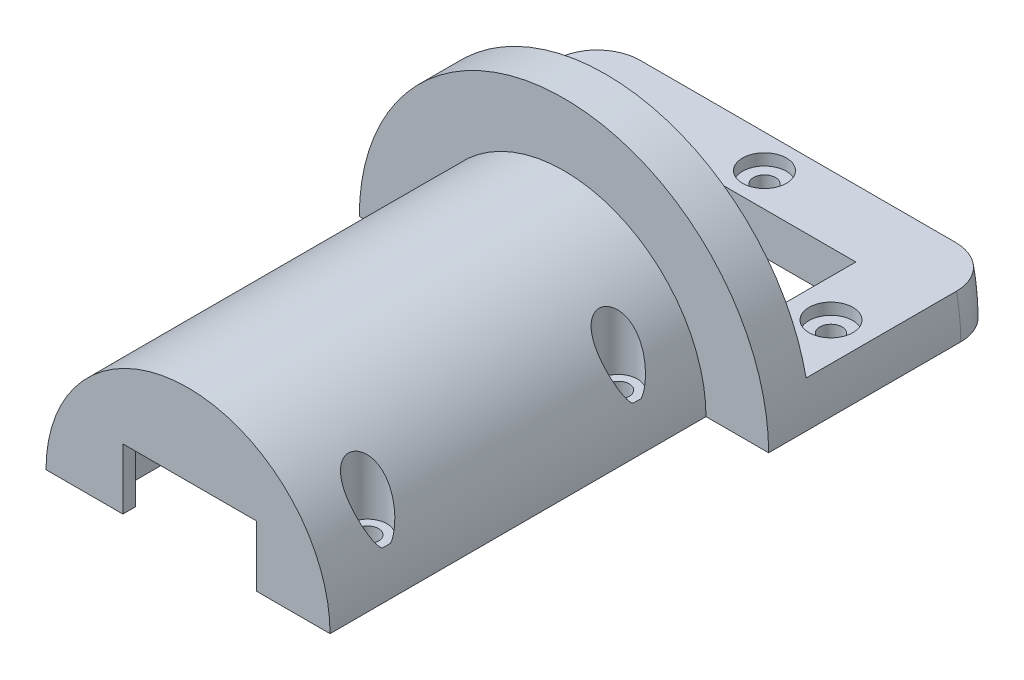
from build123d import *
from build123d.topology import SkipClean

# Parameters (mm, degrees)
ESQUISSE2_R                                      = 31.5
ESQUISSE2_W                                      = 32
ESQUISSE2_H                                      = 32
BOSS_EXTRU_1_DEPTH                               = 3
BOSS_EXTRU_2_START                               = -100
ESQUISSE4_R                                      = 35
ESQUISSE4_R_2                                    = 31.5
BOSS_EXTRU_2_DEPTH                               = 100
BOSS_EXTRU_3_OUTLINE_R                           = 31.5
BOSS_EXTRU_3_OUTLINE_W                           = 43
BOSS_EXTRU_3_OUTLINE_H                           = 42.5
BOSS_EXTRU_3_DEPTH                               = 97
ESQUISSE6_R                                      = 31.5
ENL_V_MAT_EXTRU_1_DEPTH                          = 10
ESQUISSE7_R                                      = 49
ESQUISSE7_R_2                                    = 35
BOSS_EXTRU_4_DEPTH                               = 10
BOSS_EXTRU_5_START                               = 30
BOSS_EXTRU_5_DEPTH                               = 30
BOSS_EXTRU_6_START                               = 16
BOSS_EXTRU_6_DEPTH                               = 16
CONG_1_R                                         = 10
ESQUISSE11_W                                     = 137.068824
ESQUISSE11_H                                     = 50.889867
ENL_V_MAT_EXTRU_2_DEPTH                          = 153
CHAMBRAGE_POUR_VIS_T_TE_RONDE_6_PANS_D           = 5.3
CHAMBRAGE_POUR_VIS_T_TE_RONDE_6_PANS_DEPTH       = 18
CHAMBRAGE_POUR_VIS_T_TE_RONDE_6_PANS_CBORE_D     = 10.5
CHAMBRAGE_POUR_VIS_T_TE_RONDE_6_PANS_CBORE_DEPTH = 2.75
CHAMBRAGE_POUR_VIS_T_TE_RONDE_6_PANS_TIP         = 1.592281
ESQUISSE18_R                                     = 2.6
ENL_V_MAT_EXTRU_4_DEPTH                          = 25
ESQUISSE19_R                                     = 4.6
ENL_V_MAT_EXTRU_5_DEPTH                          = 25
ENL_V_START                                      = -90
ENL_V_MAT_EXTRU_6_DEPTH                          = 90


# Read off the part's stored shape, not the designer's step: Boss.-Extru.3
with BuildPart() as part:
    # Esquisse2 → Boss.-Extru.1 (new body)
    with BuildSketch(Plane.XY):
        Circle(ESQUISSE2_R)
        with Locations((0.409228, -1.432297)):
            Rectangle(ESQUISSE2_W, ESQUISSE2_H, mode=Mode.SUBTRACT)
    extrude(amount=BOSS_EXTRU_1_DEPTH)

    # Esquisse4 → Boss.-Extru.2 (add)
    with BuildSketch(Plane.XY.offset(3).offset(BOSS_EXTRU_2_START)):
        Circle(ESQUISSE4_R)
        Circle(ESQUISSE4_R_2, mode=Mode.SUBTRACT)
    extrude(amount=BOSS_EXTRU_2_DEPTH)

    # Boss.-Extru.3 outline → Boss.-Extru.3 (add)
    with BuildSketch(Plane(origin=(0, 0, 0), x_dir=(-1, 0, 0), z_dir=(0, 0, -1))):
        Circle(BOSS_EXTRU_3_OUTLINE_R)
        with Locations((-0.409228, -1.182297)):
            Rectangle(BOSS_EXTRU_3_OUTLINE_W, BOSS_EXTRU_3_OUTLINE_H, mode=Mode.SUBTRACT)
    extrude(amount=BOSS_EXTRU_3_DEPTH)

    # Esquisse6 → Enlèv. mat.-Extru.1 (cut)
    with BuildSketch(Plane(origin=(0, 0, -97), x_dir=(-1, 0, 0), z_dir=(0, 0, -1))):
        Circle(ESQUISSE6_R)
    extrude(amount=-ENL_V_MAT_EXTRU_1_DEPTH, mode=Mode.SUBTRACT)

    # Esquisse7 → Boss.-Extru.4 (add)
    with BuildSketch(Plane(origin=(0, 0, -97), x_dir=(-1, 0, 0), z_dir=(0, 0, -1))):
        Circle(ESQUISSE7_R)
        with Locations(Location((0, 0, 0), (0, 0, 180))):
            Circle(ESQUISSE7_R_2, mode=Mode.SUBTRACT)
    extrude(amount=-BOSS_EXTRU_4_DEPTH)

    # Esquisse8 → Boss.-Extru.5 (add)
    with SkipClean():  # the faces are left unmerged after this step: merging them gives an invalid solid
        with BuildSketch(Plane(origin=(0, 0, -97), x_dir=(-1, 0, 0), z_dir=(0, 0, -1)).offset(BOSS_EXTRU_5_START)):
            with BuildLine():
                Line((-47.96874, 10), (-29.870554, 10))
                ThreePointArc((-29.870554, 10), (-31.5, 0), (-29.870554, -10))
                Line((-29.870554, -10), (-47.96874, -10))
                ThreePointArc((-47.96874, -10), (-49, 0), (-47.96874, 10))
            make_face()
            with BuildLine():
                Line((29.870554, 10), (47.96874, 10))
                ThreePointArc((47.96874, 10), (49, 0), (47.96874, -10))
                Line((47.96874, -10), (29.870554, -10))
                ThreePointArc((29.870554, -10), (31.5, 0), (29.870554, 10))
            make_face()
        extrude(amount=-BOSS_EXTRU_5_DEPTH)

    # Esquisse10 → Boss.-Extru.6 (add)
    with SkipClean():  # the faces are left unmerged after this step: merging them gives an invalid solid
        with BuildSketch(Plane(origin=(0, 0, -127), x_dir=(-1, 0, 0), z_dir=(0, 0, -1)).offset(BOSS_EXTRU_6_START)):
            with BuildLine():
                Line((47.96874, 10), (-47.96874, 10))
                ThreePointArc((-47.96874, 10), (-49, 0), (-47.96874, -10))
                Line((-47.96874, -10), (47.96874, -10))
                ThreePointArc((47.96874, -10), (49, 0), (47.96874, 10))
            make_face()
        extrude(amount=-BOSS_EXTRU_6_DEPTH)

    # Congé1
    cong_1_edges = [part.edges().sort_by_distance(p)[0] for p in [
        (-49, 0, -143),
        (49, 0, -143),
    ]]
    fillet(cong_1_edges, radius=CONG_1_R)

    # Esquisse11 → Enlèv. mat.-Extru.2 (cut)
    with SkipClean():  # the faces are left unmerged after this step: merging them gives an invalid solid
        with BuildSketch(Plane(origin=(0, 0, -143), x_dir=(-1, 0, 0), z_dir=(0, 0, -1))):
            with Locations((0, -25.444933)):
                Rectangle(ESQUISSE11_W, ESQUISSE11_H)
        extrude(amount=-ENL_V_MAT_EXTRU_2_DEPTH, mode=Mode.SUBTRACT)

    # Chambrage pour Vis à tête ronde à 6 pans creux M51
    with Locations(Plane(origin=(0, 10, 0), x_dir=(1, 0, 0), z_dir=(0, 1, 0))):
        with Locations((-38.919647, 112), (38.919647, 112), (0, 135)):
            CounterBoreHole(CHAMBRAGE_POUR_VIS_T_TE_RONDE_6_PANS_D / 2, CHAMBRAGE_POUR_VIS_T_TE_RONDE_6_PANS_CBORE_D / 2, CHAMBRAGE_POUR_VIS_T_TE_RONDE_6_PANS_CBORE_DEPTH, depth=CHAMBRAGE_POUR_VIS_T_TE_RONDE_6_PANS_DEPTH)
            with Locations((0, 0, -(CHAMBRAGE_POUR_VIS_T_TE_RONDE_6_PANS_DEPTH + CHAMBRAGE_POUR_VIS_T_TE_RONDE_6_PANS_TIP / 2))):  # 118° drill point
                Cone(0, CHAMBRAGE_POUR_VIS_T_TE_RONDE_6_PANS_D / 2, CHAMBRAGE_POUR_VIS_T_TE_RONDE_6_PANS_TIP, mode=Mode.SUBTRACT)

    # Esquisse18 → Enlèv. mat.-Extru.4 (cut, symmetric)
    with SkipClean():  # the faces are left unmerged after this step: merging them gives an invalid solid
        with BuildSketch(Plane(origin=(0, 15, 0), x_dir=(-1, 0, 0), z_dir=(0, -1, 0))):
            with Locations(Location((28, 12, 0), (0, 0, 90))):
                Circle(ESQUISSE18_R)
            with Locations(Location((-28, 12, 0), (0, 0, 90))):
                Circle(ESQUISSE18_R)
            with Locations(Location((28, 72, 0), (0, 0, 90))):
                Circle(ESQUISSE18_R)
            with Locations(Location((-28, 72, 0), (0, 0, 90))):
                Circle(ESQUISSE18_R)
        extrude(amount=ENL_V_MAT_EXTRU_4_DEPTH, both=True, mode=Mode.SUBTRACT)

    # Esquisse19 → Enlèv. mat.-Extru.5 (cut)
    with SkipClean():  # the faces are left unmerged after this step: merging them gives an invalid solid
        with BuildSketch(Plane.ZX.offset(35)):
            with Locations((-72, 28)):
                Circle(ESQUISSE19_R)
            with Locations((-12, 28)):
                Circle(ESQUISSE19_R)
            with Locations((-12, -28)):
                Circle(ESQUISSE19_R)
            with Locations((-72, -28)):
                Circle(ESQUISSE19_R)
        extrude(amount=-ENL_V_MAT_EXTRU_5_DEPTH, mode=Mode.SUBTRACT)

    # Esquisse20 → Enlèv. mat.-Extru.6 (cut)
    with SkipClean():  # the faces are left unmerged after this step: merging them gives an invalid solid
        with BuildSketch(Plane.XY.offset(3).offset(ENL_V_START)):
            with BuildLine():
                Line((-35, 0), (-34, 0))
                ThreePointArc((-34, 0), (0, 34), (34, 0))
                Line((34, 0), (35, 0))
                ThreePointArc((35, 0), (0, 35), (-35, 0))
            make_face()
        extrude(amount=ENL_V_MAT_EXTRU_6_DEPTH, mode=Mode.SUBTRACT)


solid = part.part
